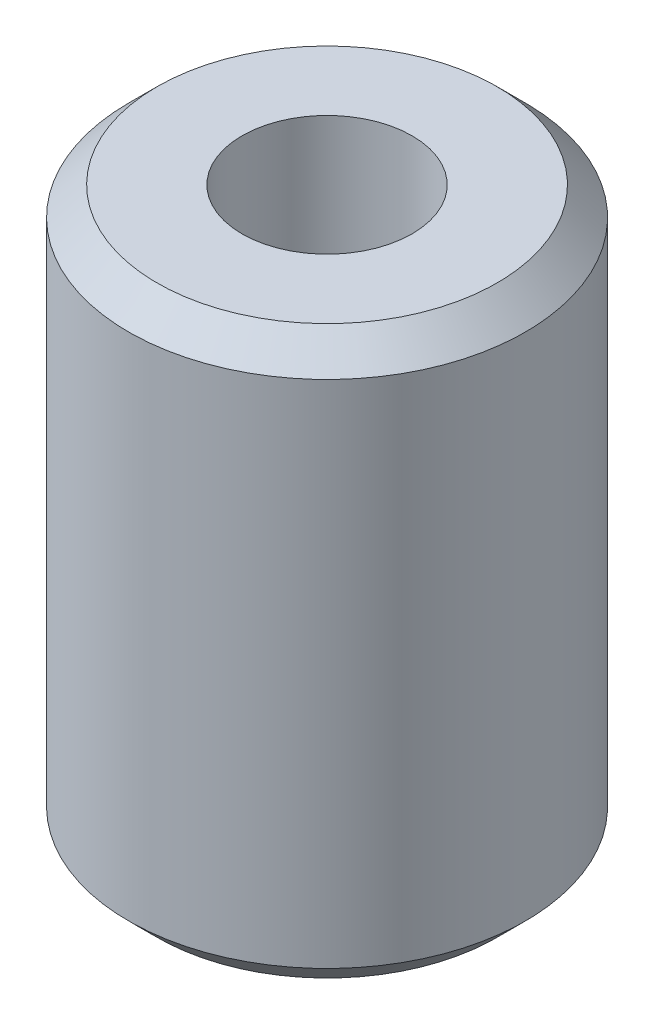
from build123d import *


with BuildPart() as part:
    # Sketch1 → Revolve1 (revolve)
    with BuildSketch(Plane.XY):
        Polygon((1.5, -5), (1.5, 5), (3, 5), (3.5, 4.5), (3.5, -4.5), (3, -5), align=None)
    revolve(axis=Axis((0, 5, 0), (0, -1, 0)))


solid = part.part
